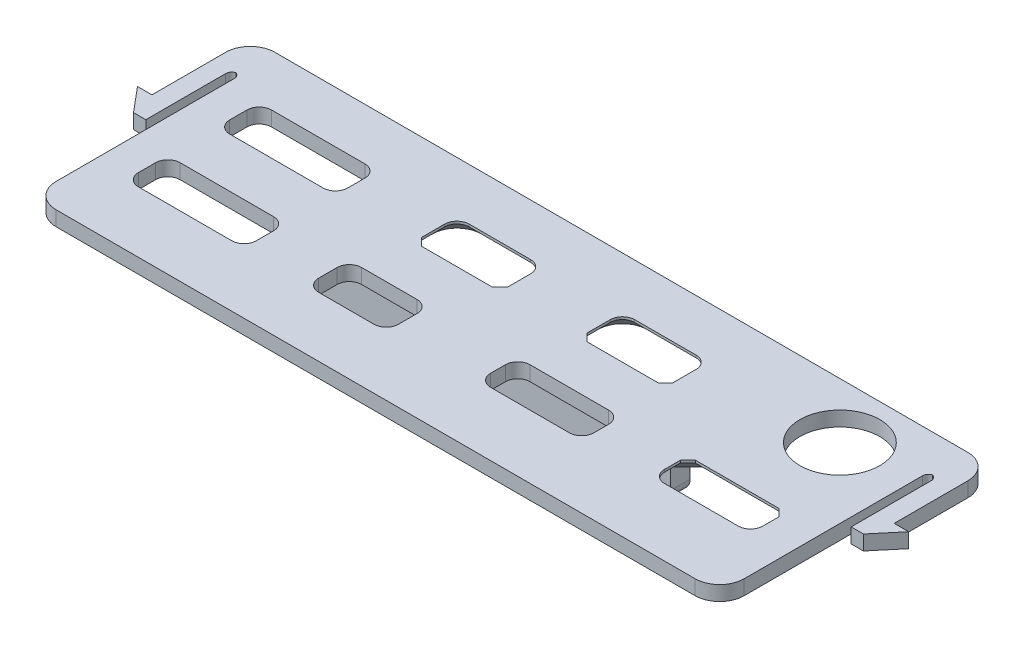
from build123d import *

# Parameters (mm, degrees)
SKETCH_1_W          = 60
SKETCH_1_H          = 20
EXTRUDE_1_DEPTH     = 1.2
CUT_EXTRUDE_1_REACH = 33.646
SKETCH_4_R          = 3.25
SKETCH_4_W          = 9.6
SKETCH_4_H          = 3.4
SKETCH_4_W_2        = 7
SKETCH_4_H_2        = 3.5
SKETCH_4_W_3        = 8
SKETCH_4_H_3        = 2.9
SKETCH_4_W_4        = 8.4
SKETCH_4_H_4        = 3.2
SKETCH_4_W_5        = 6.5
FILLET_2_R          = 1
CHAMFER_1_SIZE      = 0.6
SKETCH_5_W          = 1.5
SKETCH_5_H          = 8
EXTRUDE_2_DEPTH     = 1.2
SKETCH_6_W          = 28.5
SKETCH_6_H          = 1.6
EXTRUDE_3_DEPTH     = 4
FILLET_3_R          = 1
CHAMFER_2_SIZE      = 1
CHAMFER_4_SIZE      = 1
SKETCH_7_W          = 2
SKETCH_7_H          = 20
CUT_EXTRUDE_2_DEPTH = 5
EXTRUDE_5_DEPTH     = 1.2
FILLET_5_R          = 2
FILLET_6_R          = 0.5
CHAMFER_5_SIZE      = 2
CHAMFER_5_SIZE_2    = 2.383507185
CHAMFER_6_SIZE      = 2
CHAMFER_6_SIZE_2    = 2.383507185


with BuildPart() as part:
    # 草图1 → 凸台-拉伸1 (new body)
    with BuildSketch(Plane(origin=(0, 0, 0), x_dir=(1, 0, 0), z_dir=(0, 1, 0))):
        Rectangle(SKETCH_1_W, SKETCH_1_H)
    extrude(amount=EXTRUDE_1_DEPTH)

    # 草图4 → 切除-拉伸1 (cut, up to next)
    with BuildSketch(Plane(origin=(0, 1.2, 0), x_dir=(1, 0, 0), z_dir=(0, 1, 0)), mode=Mode.PRIVATE) as cut_extrude_1_sk1:
        with Locations(Location((22.298485985, 5.48318929, 0), (0, 0, 270))):
            Circle(SKETCH_4_R)
    cut_extrude_1_tool1 = extrude(cut_extrude_1_sk1.sketch, amount=-CUT_EXTRUDE_1_REACH, mode=Mode.PRIVATE) & part.part
    # 草图4 → 切除-拉伸1 (cut, up to next)
    with BuildSketch(Plane(origin=(0, 1.2, 0), x_dir=(1, 0, 0), z_dir=(0, 1, 0)), mode=Mode.PRIVATE) as cut_extrude_1_sk2:
        with Locations((-20.471722325, 4.1)):
            Rectangle(SKETCH_4_W, SKETCH_4_H)
    cut_extrude_1_tool2 = extrude(cut_extrude_1_sk2.sketch, amount=-CUT_EXTRUDE_1_REACH, mode=Mode.PRIVATE) & part.part
    # 草图4 → 切除-拉伸1 (cut, up to next)
    with BuildSketch(Plane(origin=(0, 1.2, 0), x_dir=(1, 0, 0), z_dir=(0, 1, 0)), mode=Mode.PRIVATE) as cut_extrude_1_sk3:
        with Locations((-5.682926277, 4.05)):
            Rectangle(SKETCH_4_W_2, SKETCH_4_H_2)
    cut_extrude_1_tool3 = extrude(cut_extrude_1_sk3.sketch, amount=-CUT_EXTRUDE_1_REACH, mode=Mode.PRIVATE) & part.part
    # 草图4 → 切除-拉伸1 (cut, up to next)
    with BuildSketch(Plane(origin=(0, 1.2, 0), x_dir=(1, 0, 0), z_dir=(0, 1, 0)), mode=Mode.PRIVATE) as cut_extrude_1_sk4:
        with Locations((7.788485985, 4.05)):
            Rectangle(SKETCH_4_W_2, SKETCH_4_H_2)
    cut_extrude_1_tool4 = extrude(cut_extrude_1_sk4.sketch, amount=-CUT_EXTRUDE_1_REACH, mode=Mode.PRIVATE) & part.part
    # 草图4 → 切除-拉伸1 (cut, up to next)
    with BuildSketch(Plane(origin=(0, 1.2, 0), x_dir=(1, 0, 0), z_dir=(0, 1, 0)), mode=Mode.PRIVATE) as cut_extrude_1_sk5:
        with Locations((21.05, -3.084803861)):
            Rectangle(SKETCH_4_W_3, SKETCH_4_H_3)
    cut_extrude_1_tool5 = extrude(cut_extrude_1_sk5.sketch, amount=-CUT_EXTRUDE_1_REACH, mode=Mode.PRIVATE) & part.part
    # 草图4 → 切除-拉伸1 (cut, up to next)
    with BuildSketch(Plane(origin=(0, 1.2, 0), x_dir=(1, 0, 0), z_dir=(0, 1, 0)), mode=Mode.PRIVATE) as cut_extrude_1_sk6:
        with Locations((7.4, -3.234803861)):
            Rectangle(SKETCH_4_W_4, SKETCH_4_H_4)
    cut_extrude_1_tool6 = extrude(cut_extrude_1_sk6.sketch, amount=-CUT_EXTRUDE_1_REACH, mode=Mode.PRIVATE) & part.part
    # 草图4 → 切除-拉伸1 (cut, up to next)
    with BuildSketch(Plane(origin=(0, 1.2, 0), x_dir=(1, 0, 0), z_dir=(0, 1, 0)), mode=Mode.PRIVATE) as cut_extrude_1_sk7:
        with Locations((-7.25, -3.384803861)):
            Rectangle(SKETCH_4_W_5, SKETCH_4_H_2)
    cut_extrude_1_tool7 = extrude(cut_extrude_1_sk7.sketch, amount=-CUT_EXTRUDE_1_REACH, mode=Mode.PRIVATE) & part.part
    # 草图4 → 切除-拉伸1 (cut, up to next)
    with BuildSketch(Plane(origin=(0, 1.2, 0), x_dir=(1, 0, 0), z_dir=(0, 1, 0)), mode=Mode.PRIVATE) as cut_extrude_1_sk8:
        with Locations((-20.471722325, -3.334803861)):
            Rectangle(SKETCH_4_W, SKETCH_4_H)
    cut_extrude_1_tool8 = extrude(cut_extrude_1_sk8.sketch, amount=-CUT_EXTRUDE_1_REACH, mode=Mode.PRIVATE) & part.part
    add(cut_extrude_1_tool1.solids().sort_by_distance((22.298486, 1.2, -5.483189))[0], mode=Mode.SUBTRACT)
    add(cut_extrude_1_tool2.solids().sort_by_distance((-20.471722, 1.2, -4.1))[0], mode=Mode.SUBTRACT)
    add(cut_extrude_1_tool3.solids().sort_by_distance((-5.682926, 1.2, -4.05))[0], mode=Mode.SUBTRACT)
    add(cut_extrude_1_tool4.solids().sort_by_distance((7.788486, 1.2, -4.05))[0], mode=Mode.SUBTRACT)
    add(cut_extrude_1_tool5.solids().sort_by_distance((21.05, 1.2, 3.084804))[0], mode=Mode.SUBTRACT)
    add(cut_extrude_1_tool6.solids().sort_by_distance((7.4, 1.2, 3.234804))[0], mode=Mode.SUBTRACT)
    add(cut_extrude_1_tool7.solids().sort_by_distance((-7.25, 1.2, 3.384804))[0], mode=Mode.SUBTRACT)
    add(cut_extrude_1_tool8.solids().sort_by_distance((-20.471722, 1.2, 3.334804))[0], mode=Mode.SUBTRACT)

    # 圆角2
    fillet_2_edges = [part.edges().sort_by_distance(p)[0] for p in [
        (-9.182926277, 0.6, -5.8),
        (-2.182926277, 0.6, -5.8),
        (4.288485985, 0.6, -5.8),
        (11.288485985, 0.6, -5.8),
        (17.05, 0.6, 4.534803861),
        (25.05, 0.6, 4.534803861),
        (3.2, 0.6, 4.834803861),
        (3.2, 0.6, 1.634803861),
        (11.6, 0.6, 1.634803861),
        (11.6, 0.6, 4.834803861),
        (-10.5, 0.6, 5.134803861),
        (-10.5, 0.6, 1.634803861),
        (-4, 0.6, 1.634803861),
        (-4, 0.6, 5.134803861),
        (-25.271722325, 0.6, 5.034803861),
        (-25.271722325, 0.6, 1.634803861),
        (-15.671722325, 0.6, 1.634803861),
        (-15.671722325, 0.6, 5.034803861),
        (-25.271722325, 0.6, -2.4),
        (-25.271722325, 0.6, -5.8),
        (-15.671722325, 0.6, -5.8),
        (-15.671722325, 0.6, -2.4),
    ]]
    fillet(fillet_2_edges, radius=FILLET_2_R)

    # 倒角1
    chamfer_1_edges = [part.edges().sort_by_distance(p)[0] for p in [
        (-9.182926277, 0.6, -2.3),
        (-2.182926277, 0.6, -2.3),
        (4.288485985, 0.6, -2.3),
        (11.288485985, 0.6, -2.3),
        (17.05, 0.6, 1.634803861),
        (25.05, 0.6, 1.634803861),
    ]]
    chamfer(chamfer_1_edges, length=CHAMFER_1_SIZE)

    # 草图5 → 凸台-拉伸2 (add)
    with BuildSketch(Plane.XZ):
        with Locations((-13.15891381, -0.88318929)):
            Rectangle(SKETCH_5_W, SKETCH_5_H)
        with Locations((13.84108619, -0.88318929)):
            Rectangle(SKETCH_5_W, SKETCH_5_H)
    extrude(amount=EXTRUDE_2_DEPTH)

    # 草图6 → 凸台-拉伸3 (add)
    with BuildSketch(Plane.XZ):
        with Locations((0.34108619, -0.2)):
            Rectangle(SKETCH_6_W, SKETCH_6_H)
    extrude(amount=EXTRUDE_3_DEPTH)

    # 圆角3
    fillet_3_edges = [part.edges().sort_by_distance(p)[0] for p in [
        (-13.90891381, -4, -0.2),
        (14.59108619, -4, -0.2),
    ]]
    fillet(fillet_3_edges, radius=FILLET_3_R)

    # 倒角2
    chamfer_2_edges = [part.edges().sort_by_distance(p)[0] for p in [
        (-13.15891381, -1.2, -4.88318929),
        (-13.15891381, -1.2, 3.11681071),
        (13.84108619, -1.2, -4.88318929),
        (13.84108619, -1.2, 3.11681071),
    ]]
    chamfer(chamfer_2_edges, length=CHAMFER_2_SIZE)

    # 倒角4
    chamfer_4_edges = [part.edges().sort_by_distance(p)[0] for p in [
        (-5.682926277, 0, -5.8),
        (-2.182926277, 0, -3.85),
        (7.788485985, 0, -5.8),
        (11.288485985, 0, -3.85),
        (21.05, 0, 4.534803861),
        (17.05, 0, 2.884803861),
        (-2.475819496, 0, -5.507106781),
        (-8.890033058, 0, -5.507106781),
        (4.581379204, 0, -5.507106781),
        (10.995592766, 0, -5.507106781),
        (24.757106781, 0, 4.241910642),
        (17.342893219, 0, 4.241910642),
        (-5.682926277, 0, -2.3),
        (-9.182926277, 0, -3.85),
        (7.788485985, 0, -2.3),
        (4.288485985, 0, -3.85),
        (21.05, 0, 1.634803861),
        (25.05, 0, 2.884803861),
        (-8.882926277, 0, -2.6),
        (-2.482926277, 0, -2.6),
        (4.588485985, 0, -2.6),
        (10.988485985, 0, -2.6),
        (17.35, 0, 1.934803861),
        (24.75, 0, 1.934803861),
    ]]
    chamfer(chamfer_4_edges, length=CHAMFER_4_SIZE)

    # 草图7 → 切除-拉伸2 (cut)
    with BuildSketch(Plane(origin=(0, 1.2, 0), x_dir=(1, 0, 0), z_dir=(0, 1, 0))):
        with Locations((29, 0)):
            Rectangle(SKETCH_7_W, SKETCH_7_H)
        with Locations((-29, 0)):
            Rectangle(SKETCH_7_W, SKETCH_7_H)
    extrude(amount=-CUT_EXTRUDE_2_DEPTH, mode=Mode.SUBTRACT)

    # 草图11 → 凸台-拉伸5 (add)
    with BuildSketch(Plane(origin=(0, 1.2, 0), x_dir=(1, 0, 0), z_dir=(0, 1, 0))):
        Polygon((28, 10), (30.2, 10), (30.2, 2), (31.7, 2), (31.7, 0), (28.7, 0), (28.7, 7), (28, 7), align=None)
        Polygon((-28, 10), (-30.2, 10), (-30.2, 2), (-31.7, 2), (-31.7, 0), (-28.7, 0), (-28.7, 7), (-28, 7), align=None)
    extrude(amount=-EXTRUDE_5_DEPTH)

    # 圆角5
    fillet_5_edges = [part.edges().sort_by_distance(p)[0] for p in [
        (28, 0.6, 10),
        (-28, 0.6, 10),
        (30.2, 0.6, -10),
        (-30.2, 0.6, -10),
    ]]
    fillet(fillet_5_edges, radius=FILLET_5_R)

    # 圆角6
    # the kernel refuses this fillet: 0.5 mm, written as the material it adds along each edge
    with BuildSketch(Plane(origin=(28, 1.2, -7), x_dir=(0, 0, 1), z_dir=(0, -1, 0)), Plane(origin=(28.7, 1.2, -7), x_dir=(-1, 0, 0), z_dir=(0, -1, 0))) as fillet_6_piece_1:
        with BuildLine():
            CenterArc((FILLET_6_R, -FILLET_6_R), FILLET_6_R, 90, 90)
            Line((0, -FILLET_6_R), (0, 0))
            Line((0, 0), (FILLET_6_R, 0))
        make_face()
    extrude(amount=1.2)
    with BuildSketch(Plane(origin=(-28, 1.2, -7), x_dir=(0, 0, 1), z_dir=(0, -1, 0)), Plane(origin=(-28.7, 1.2, -7), x_dir=(1, 0, 0), z_dir=(0, -1, 0))) as fillet_6_piece_2:
        with BuildLine():
            CenterArc((FILLET_6_R, FILLET_6_R), FILLET_6_R, 180, 90)
            Line((0, FILLET_6_R), (0, 0))
            Line((0, 0), (FILLET_6_R, 0))
        make_face()
    extrude(amount=1.2)

    # 倒角5
    # the kernel refuses this chamfer: 2.383507185, 2 mm, written as the material it takes off along each edge
    with BuildSketch(Plane(origin=(31.7, 7.343265966, 0), x_dir=(-0.9993728857116148, 0, 0.03540953691366325), z_dir=(0, -1, 0))) as chamfer_5_piece_1:
        Polygon((CHAMFER_5_SIZE * 0.999372885712, CHAMFER_5_SIZE * 0.0354095369137), (-CHAMFER_5_SIZE_2 * 0.0354095369165, CHAMFER_5_SIZE_2 * 0.999372885791), (0, 0), align=None)
    extrude(amount=13.486531933, mode=Mode.SUBTRACT)

    # 倒角6
    # the kernel refuses this chamfer: 2.383507185, 2 mm, written as the material it takes off along each edge
    with BuildSketch(Plane(origin=(-31.7, 7.343265966, 0), x_dir=(0.9993728857116148, 0, 0.03540953691366311), z_dir=(0, -1, 0))) as chamfer_6_piece_1:
        Polygon((CHAMFER_6_SIZE * 0.999372885712, -CHAMFER_6_SIZE * 0.0354095369137), (-CHAMFER_6_SIZE_2 * 0.0354095369165, -CHAMFER_6_SIZE_2 * 0.999372885791), (0, 0), align=None)
    extrude(amount=13.486531933, mode=Mode.SUBTRACT)


solid = part.part
